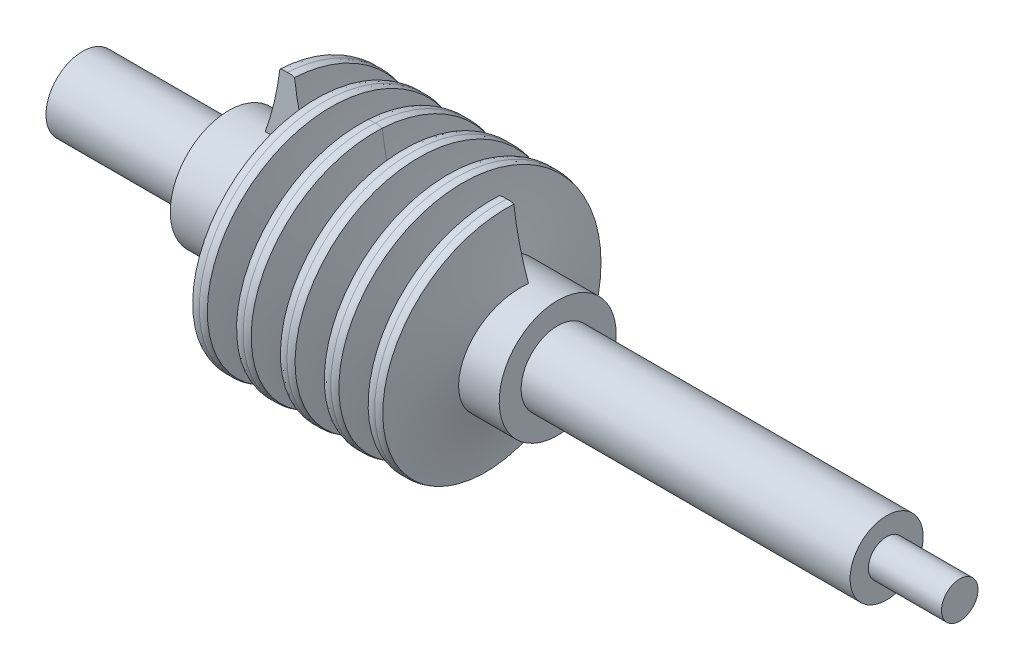
from build123d import *

# Parameters (mm, degrees)
SWEEP1_PITCH = 6
SWEEP2_PITCH = 6


with BuildPart() as part:
    # Sketch1 → Revolve1 (revolve)
    with BuildSketch(Plane.XY):
        Polygon((0, 0), (0, 5), (20, 5), (20, 8), (65, 8), (65, 5), (110, 5), (110, 2.5), (120, 2.5), (120, 0), align=None)
    revolve(axis=Axis((120, 0, 0), (-1, 0, 0)))

    # Sweep1: the profile of Sketch3 screwed along a left-hand helix of 2 turns, 14 arcs to a turn; built about Z, then put on its axis
    sweep1_z = Axis((0, 0, 0), (0, 0, 1))
    sweep1_corners = [(6, 0, -3), (6, 0, 3), (8, 0, 3), (16.4, 0, 1), (16.5, 0, 0), (16.4, 0, -1), (8, 0, -3)]
    with BuildLine(mode=Mode.PRIVATE) as sweep1_profile:
        Line(sweep1_corners[0], sweep1_corners[1])
        Line(sweep1_corners[1], sweep1_corners[2])
        Line(sweep1_corners[6], sweep1_corners[0])
        ThreePointArc((8, 0, 3), (12.144478002, 0, 1.766807607), (16.4, 0, 1))
        ThreePointArc((16.4, 0, 1), (16.521206253, 0, 0.507120625), (16.5, 0, 0))
        ThreePointArc((16.5, 0, 0), (16.521206253, 0, -0.507120625), (16.4, 0, -1))
        ThreePointArc((16.4, 0, -1), (12.144478002, 0, -1.766807607), (8, 0, -3))
    sweep1_cap = Face(sweep1_profile.wire())
    sweep1_arcs = [((8, 0, 3), (12.08861263, 0, 1.532173048), (16.4, 0, 1), (1, 0.9938535629900324, 1)), ((16.4, 0, 1), (16.595360611, 0, 0.514536061), (16.5, 0, 0), (1, 0.9602436676357532, 1)), ((16.5, 0, 0), (16.595360611, 0, -0.514536061), (16.4, 0, -1), (1, 0.9602436676357533, 1)), ((16.4, 0, -1), (12.08861263, 0, -1.532173048), (8, 0, -3), (1, 0.9938535629900321, 1))]  # start, shoulder, end, weights
    sweep1_turn_angles = [0, -12.857142857, -25.714285714, -38.571428571, -51.428571429, -64.285714286, -77.142857143, -90, -102.857142857, -115.714285714, -128.571428571, -141.428571429, -154.285714286, -167.142857143, -180, -192.857142857, -205.714285714, -218.571428571, -231.428571429, -244.285714286, -257.142857143, -270, -282.857142857, -295.714285714, -308.571428571, -321.428571429, -334.285714286, -347.142857143, -360]
    sweep1_turn_weights = [1, 0.9749279121818236, 1, 0.9749279121818236, 1, 0.9749279121818236, 1, 0.9749279121818236, 1, 0.9749279121818236, 1, 0.9749279121818236, 1, 0.9749279121818236, 1, 0.9749279121818236, 1, 0.9749279121818236, 1, 0.9749279121818236, 1, 0.9749279121818236, 1, 0.9749279121818237, 1, 0.9749279121818236, 1, 0.9749279121818236, 1]
    sweep1_turn_rails = [Edge.make_bspline([Vector(p[0], p[1], 0).rotate(sweep1_z, sweep1_turn_angles[k]) / sweep1_turn_weights[k] + Vector(0, 0, p[2] + -SWEEP1_PITCH * sweep1_turn_angles[k] / 360) for k in range(29)], [0, 0, 0, 1, 1, 2, 2, 3, 3, 4, 4, 5, 5, 6, 6, 7, 7, 8, 8, 9, 9, 10, 10, 11, 11, 12, 12, 13, 13, 14, 14, 14], 2, sweep1_turn_weights) for p in sweep1_corners]
    sweep1_turn_sides = [*[Face.make_surface_from_curves(sweep1_turn_rails[p[0]], sweep1_turn_rails[p[1]]) for p in [(0, 1), (1, 2), (6, 0)]], *[Face.make_bezier_surface([[Vector(p[j][0], p[j][1], 0).rotate(sweep1_z, sweep1_turn_angles[2 * i + k]) / sweep1_turn_weights[2 * i + k] + Vector(0, 0, p[j][2] + -SWEEP1_PITCH * sweep1_turn_angles[2 * i + k] / 360) for k in range(3)] for j in range(3)], [[p[3][j] * sweep1_turn_weights[2 * i + k] for k in range(3)] for j in range(3)]) for p in sweep1_arcs for i in range(14)]]
    sweep1_turn = Solid(Shell([*sweep1_turn_sides, sweep1_cap, sweep1_cap.rotate(sweep1_z, -360).moved(Location((0, 0, -SWEEP1_PITCH * -360 / 360)))]))
    sweep1_each = [*[sweep1_turn.moved(Location((0, 0, SWEEP1_PITCH * i))) for i in range(2)]]
    add(Plane(origin=(40, 0, 0), x_dir=(0, 1, 0), z_dir=(-1, 0, 0)) * Compound([sweep1_each[i] for i in range(0, 2, 2)]))
    add(Plane(origin=(40, 0, 0), x_dir=(0, 1, 0), z_dir=(-1, 0, 0)) * Compound([sweep1_each[i] for i in range(1, 2, 2)]))

    # Sweep2: the profile of Sketch3<2> screwed along a left-hand helix of 3 turns, 14 arcs to a turn; built about Z, then put on its axis
    sweep2_z = Axis((0, 0, 0), (0, 0, 1))
    sweep2_corners = [(6, 0, 3), (6, 0, -3), (8, 0, -3), (16.4, 0, -1), (16.5, 0, 0), (16.4, 0, 1), (8, 0, 3)]
    with BuildLine(mode=Mode.PRIVATE) as sweep2_profile:
        Line(sweep2_corners[0], sweep2_corners[1])
        Line(sweep2_corners[1], sweep2_corners[2])
        Line(sweep2_corners[6], sweep2_corners[0])
        ThreePointArc((8, 0, -3), (12.144478002, 0, -1.766807607), (16.4, 0, -1))
        ThreePointArc((16.4, 0, -1), (16.521206253, 0, -0.507120625), (16.5, 0, 0))
        ThreePointArc((16.5, 0, 0), (16.521206253, 0, 0.507120625), (16.4, 0, 1))
        ThreePointArc((16.4, 0, 1), (12.144478002, 0, 1.766807607), (8, 0, 3))
    sweep2_cap = Face(sweep2_profile.wire())
    sweep2_arcs = [((8, 0, -3), (12.08861263, 0, -1.532173048), (16.4, 0, -1), (1, 0.9938535629900324, 1)), ((16.4, 0, -1), (16.595360611, 0, -0.514536061), (16.5, 0, 0), (1, 0.9602436676357532, 1)), ((16.5, 0, 0), (16.595360611, 0, 0.514536061), (16.4, 0, 1), (1, 0.9602436676357533, 1)), ((16.4, 0, 1), (12.08861263, 0, 1.532173048), (8, 0, 3), (1, 0.9938535629900321, 1))]  # start, shoulder, end, weights
    sweep2_turn_angles = [0, -12.857142857, -25.714285714, -38.571428571, -51.428571429, -64.285714286, -77.142857143, -90, -102.857142857, -115.714285714, -128.571428571, -141.428571429, -154.285714286, -167.142857143, -180, -192.857142857, -205.714285714, -218.571428571, -231.428571429, -244.285714286, -257.142857143, -270, -282.857142857, -295.714285714, -308.571428571, -321.428571429, -334.285714286, -347.142857143, -360]
    sweep2_turn_weights = [1, 0.9749279121818236, 1, 0.9749279121818236, 1, 0.9749279121818236, 1, 0.9749279121818236, 1, 0.9749279121818236, 1, 0.9749279121818236, 1, 0.9749279121818236, 1, 0.9749279121818236, 1, 0.9749279121818236, 1, 0.9749279121818236, 1, 0.9749279121818236, 1, 0.9749279121818237, 1, 0.9749279121818236, 1, 0.9749279121818236, 1]
    sweep2_turn_rails = [Edge.make_bspline([Vector(p[0], p[1], 0).rotate(sweep2_z, sweep2_turn_angles[k]) / sweep2_turn_weights[k] + Vector(0, 0, p[2] + -SWEEP2_PITCH * sweep2_turn_angles[k] / 360) for k in range(29)], [0, 0, 0, 1, 1, 2, 2, 3, 3, 4, 4, 5, 5, 6, 6, 7, 7, 8, 8, 9, 9, 10, 10, 11, 11, 12, 12, 13, 13, 14, 14, 14], 2, sweep2_turn_weights) for p in sweep2_corners]
    sweep2_turn_sides = [*[Face.make_surface_from_curves(sweep2_turn_rails[p[0]], sweep2_turn_rails[p[1]]) for p in [(0, 1), (1, 2), (6, 0)]], *[Face.make_bezier_surface([[Vector(p[j][0], p[j][1], 0).rotate(sweep2_z, sweep2_turn_angles[2 * i + k]) / sweep2_turn_weights[2 * i + k] + Vector(0, 0, p[j][2] + -SWEEP2_PITCH * sweep2_turn_angles[2 * i + k] / 360) for k in range(3)] for j in range(3)], [[p[3][j] * sweep2_turn_weights[2 * i + k] for k in range(3)] for j in range(3)]) for p in sweep2_arcs for i in range(14)]]
    sweep2_turn = Solid(Shell([*sweep2_turn_sides, sweep2_cap, sweep2_cap.rotate(sweep2_z, -360).moved(Location((0, 0, -SWEEP2_PITCH * -360 / 360)))]))
    sweep2_each = [*[sweep2_turn.moved(Location((0, 0, SWEEP2_PITCH * i))) for i in range(3)]]
    add(Plane(origin=(40, 0, 0), x_dir=(0, 1, 0), z_dir=(1, 0, 0)) * Compound([sweep2_each[i] for i in range(0, 3, 2)]))
    add(Plane(origin=(40, 0, 0), x_dir=(0, 1, 0), z_dir=(1, 0, 0)) * Compound([sweep2_each[i] for i in range(1, 3, 2)]))


solid = part.part
